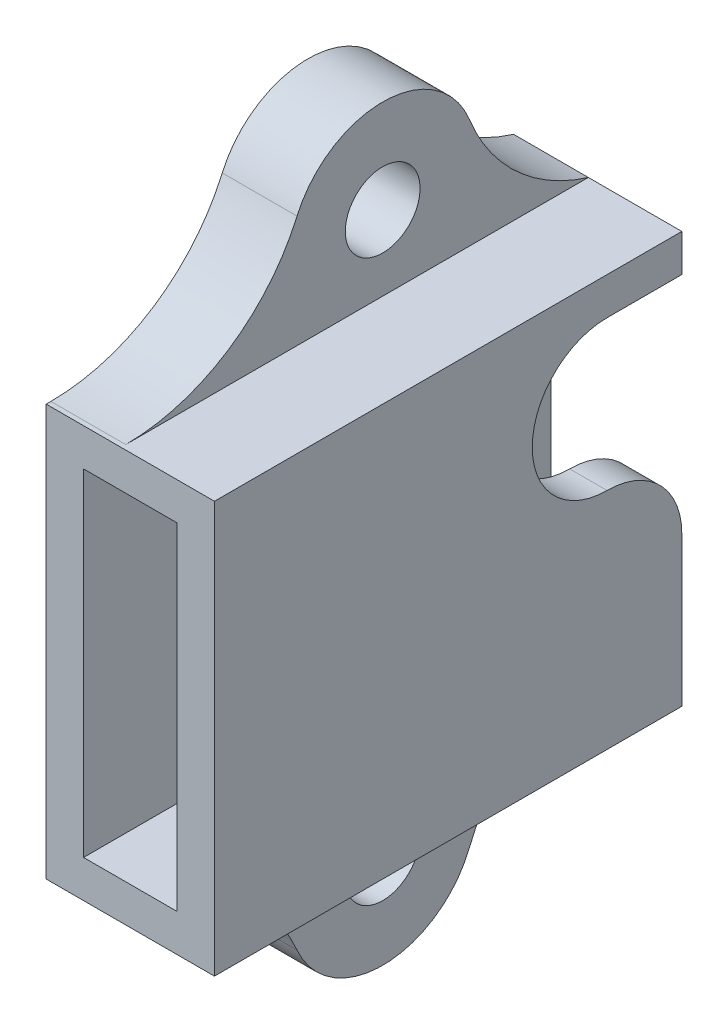
from build123d import *

# Parameters (mm, degrees)
ESQUISSE1_W             = 9
ESQUISSE1_H             = 22
ESQUISSE1_W_2           = 5
ESQUISSE1_H_2           = 18
BOSS_EXTRU_1_DEPTH      = 25
ESQUISSE2_R             = 2
BOSS_EXTRU_2_DEPTH      = 4
CONG_1_R                = 10
ESQUISSE3_W             = 8
ESQUISSE3_H             = 8
ENL_V_MAT_EXTRU_1_DEPTH = 39.923000912
CONG_2_R                = 4


# Some blends are built 0.0001 mm under size
with BuildPart() as part:
    # Esquisse1 → Boss.-Extru.1 (new body)
    with BuildSketch(Plane.XY):
        with Locations((2.5, 9)):
            Rectangle(ESQUISSE1_W, ESQUISSE1_H)
        with Locations((2.5, 9)):
            Rectangle(ESQUISSE1_W_2, ESQUISSE1_H_2, mode=Mode.SUBTRACT)
    extrude(amount=BOSS_EXTRU_1_DEPTH)

    # Esquisse2 → Boss.-Extru.2 (add)
    # profile 1 of 2: a face of its own
    with BuildSketch(Plane.ZY.offset(2)):
        with BuildLine():
            Line((6, -2), (6, -6))
            ThreePointArc((6, -6), (11, -11), (16, -6))
            Line((16, -6), (16, -2))
            Line((16, -2), (6, -2))
        make_face()
        with Locations((11, -6)):
            Circle(ESQUISSE2_R, mode=Mode.SUBTRACT)
    # profile 2 of 2: a face of its own
    with BuildSketch(Plane.ZY.offset(2)):
        with BuildLine():
            Line((6, 20), (6, 24))
            ThreePointArc((6, 24), (11, 29), (16, 24))
            Line((16, 24), (16, 20))
            Line((16, 20), (6, 20))
        make_face()
        with Locations((11, 24)):
            Circle(ESQUISSE2_R, mode=Mode.SUBTRACT)
    extrude(amount=-BOSS_EXTRU_2_DEPTH)

    # Congé1
    # the kernel refuses this fillet: 10 mm, written as the material it adds along each edge
    with BuildSketch(Plane(origin=(-2, -2, 16), x_dir=(0, 0, 1), z_dir=(1, 0, 0))) as cong_1_piece_1:
        with BuildLine():
            CenterArc((8.747727085, 10), CONG_1_R, 203.578178478, 66.421821522)
            Line((-0.417424305, 6), (-1.333939444, 5.6))
            ThreePointArc((-1.333939444, 5.6), (-1, 4), (-1, 0))
            Line((-1, 0), (0, -1))
            Line((0, -1), (8.747727085, -1))
            Line((8.747727085, -1), (8.747727085, 0))
        make_face()
    extrude(amount=4)
    with BuildSketch(Plane(origin=(-2, 20, 16), x_dir=(0, 0, 1), z_dir=(1, 0, 0))) as cong_1_piece_2:
        with BuildLine():
            CenterArc((8.747727085, -10), CONG_1_R, 90, 66.421821522)
            Line((-0.417424305, -6), (-1.333939444, -5.6))
            ThreePointArc((-1.333939444, -5.6), (-1, -4), (-1, 0))
            Line((-1, 0), (0, 1))
            Line((0, 1), (8.747727085, 1))
            Line((8.747727085, 1), (8.747727085, 0))
        make_face()
    extrude(amount=4)
    with BuildSketch(Plane(origin=(-2, -2, 6), x_dir=(0, 0, -1), z_dir=(1, 0, 0))) as cong_1_piece_3:
        with BuildLine():
            CenterArc((8.931185798, -9.560760944), CONG_1_R, 107.044753414, 51.195378821)
            Line((-0.356271401, -5.853586981), (-1.285017121, -5.482869585))
            ThreePointArc((-1.285017121, -5.482869585), (-1, -4), (-1, 0))
            Line((-1, 0), (0, 1))
            ThreePointArc((0, 1), (3, 1), (5.70688142, 0.956076094))
            Line((5.70688142, 0.956076094), (6, 0))
        make_face()
    extrude(amount=4)
    with BuildSketch(Plane(origin=(-2, 20, 6), x_dir=(0, 0, -1), z_dir=(1, 0, 0))) as cong_1_piece_4:
        with BuildLine():
            CenterArc((8.931185798, 9.560760944), CONG_1_R, 201.759867765, 51.195378821)
            Line((-0.356271401, 5.853586981), (-1.285017121, 5.482869585))
            ThreePointArc((-1.285017121, 5.482869585), (-1, 4), (-1, 0))
            Line((-1, 0), (0, -1))
            ThreePointArc((0, -1), (3, -1), (5.70688142, -0.956076094))
            Line((5.70688142, -0.956076094), (6, 0))
        make_face()
    extrude(amount=4)

    # Esquisse3 → Enlèv. mat.-Extru.1 (cut, through all)
    with BuildSketch(Plane(origin=(0, 0, 0), x_dir=(0, 0, -1), z_dir=(1, 0, 0))):
        with Locations((-4, 14)):
            Rectangle(ESQUISSE3_W, ESQUISSE3_H)
    extrude(amount=ENL_V_MAT_EXTRU_1_DEPTH, mode=Mode.SUBTRACT)

    # Congé2
    cong_2_edges = [part.edges().sort_by_distance(p)[0] for p in [
        (6, 10, 0),
        (6, 10, 8),
        (6, 18, 8),
    ]]
    fillet(cong_2_edges, radius=CONG_2_R - 0.0001)  # a hair under: the kernel refuses the full size


solid = part.part
